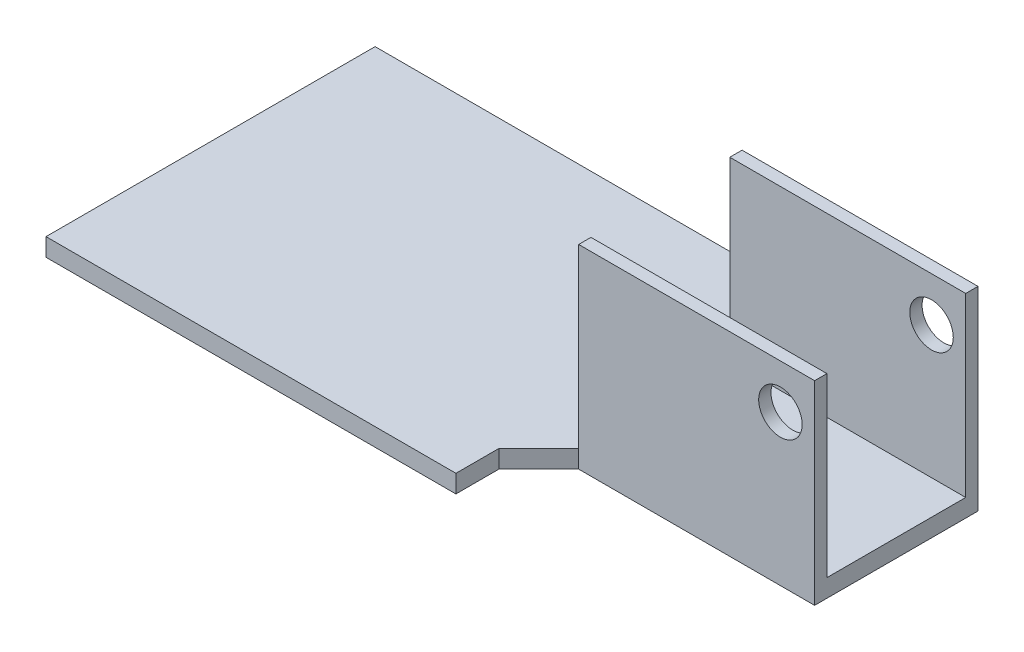
from build123d import *

# Parameters (mm, degrees)
BOSS_EXTRUDE6_DEPTH = 2.05994
SKETCH9_W           = 27.13228
SKETCH9_H           = 1.41224
BOSS_EXTRUDE7_DEPTH = 20.32
SKETCH10_R          = 2.50063
CUT_EXTRUDE3_DEPTH  = 25.4


with BuildPart() as part:
    # Sketch8 → Boss-Extrude6 (new body)
    with BuildSketch(Plane(origin=(0, 0, 0), x_dir=(1, 0, 0), z_dir=(0, 1, 0))):
        Polygon((-44.974060072, -2.900891689), (-44.974060072, -40.746891689), (2.165799928, -40.746891689), (2.165799928, -35.808024144), (6.755579928, -31.218244144), (33.887859928, -31.218244144), (33.887859928, -12.429539234), (6.755579928, -12.429539234), (2.165799928, -7.839759234), (2.165799928, -2.900891689), align=None)
    extrude(amount=BOSS_EXTRUDE6_DEPTH)

    # Sketch9 → Boss-Extrude7 (add)
    with BuildSketch(Plane(origin=(0, 2.05994, 0), x_dir=(1, 0, 0), z_dir=(0, 1, 0))):
        with Locations((20.321719928, -13.135659234)):
            Rectangle(SKETCH9_W, SKETCH9_H)
        with Locations((20.321719928, -30.512124144)):
            Rectangle(SKETCH9_W, SKETCH9_H)
    extrude(amount=BOSS_EXTRUDE7_DEPTH)

    # Sketch10 → Cut-Extrude3 (cut)
    with BuildSketch(Plane.XY.offset(31.218244144)):
        with Locations((29.955939928, 17.2847)):
            Circle(SKETCH10_R)
    extrude(amount=-CUT_EXTRUDE3_DEPTH, mode=Mode.SUBTRACT)


solid = part.part
